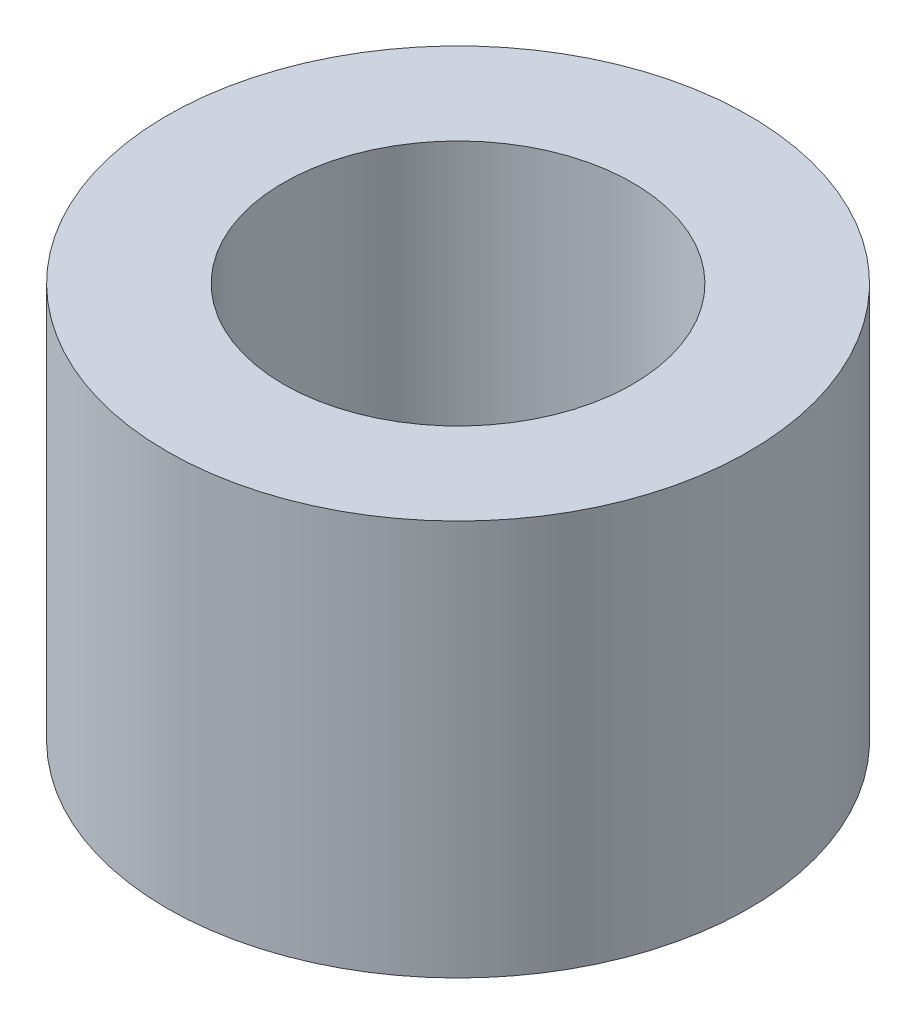
from build123d import *

# Parameters (mm, degrees)
SKETCH1_R           = 2.5
SKETCH1_R_2         = 1.5
BOSS_EXTRUDE1_DEPTH = 3.4


with BuildPart() as part:
    # Sketch1 → Boss-Extrude1 (new body)
    with BuildSketch(Plane(origin=(0, 0, 0), x_dir=(1, 0, 0), z_dir=(0, 1, 0))):
        Circle(SKETCH1_R)
        Circle(SKETCH1_R_2, mode=Mode.SUBTRACT)
    extrude(amount=BOSS_EXTRUDE1_DEPTH)


solid = part.part
